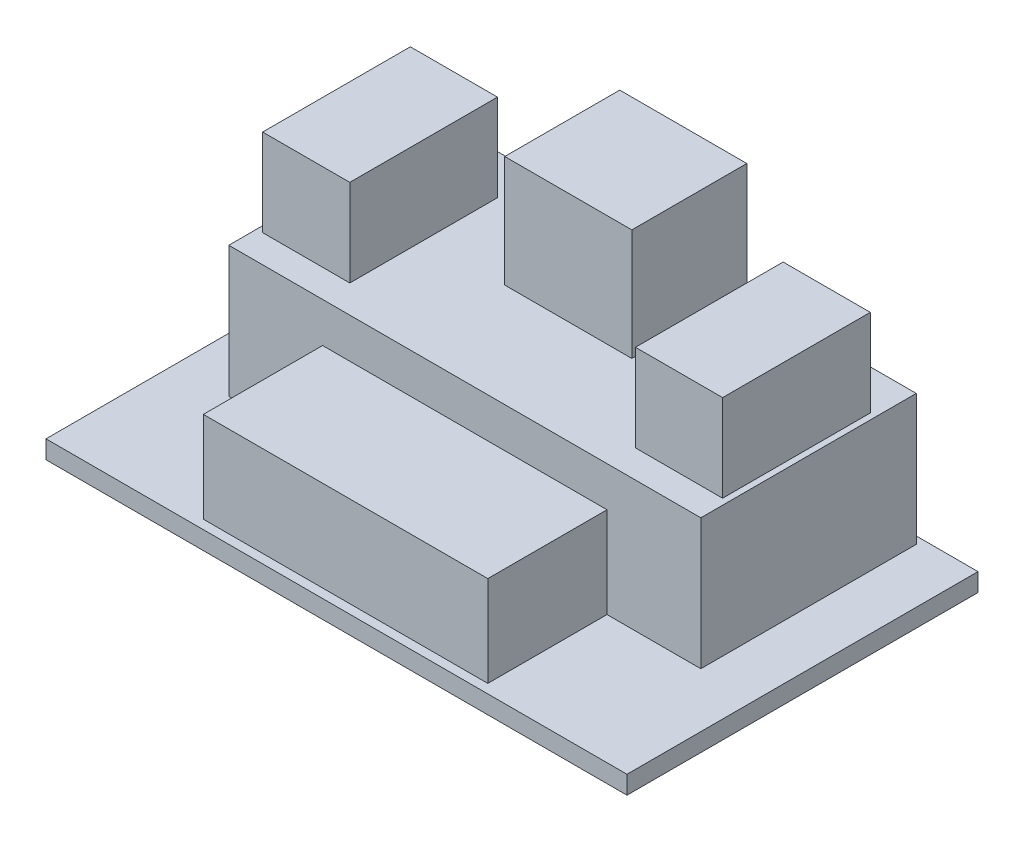
from build123d import *

# Parameters (mm, degrees)
SKETCH_1_W      = 480
SKETCH_1_H      = 290
EXTRUDE_1_DEPTH = 15
SKETCH_2_W      = 390
SKETCH_2_H      = 178
EXTRUDE_2_DEPTH = 108
SKETCH_3_W      = 235
SKETCH_3_H      = 105
EXTRUDE_3_DEPTH = 75
SKETCH_4_W      = 105
SKETCH_4_H      = 95
EXTRUDE_4_DEPTH = 200
SKETCH_5_W      = 72
SKETCH_5_H      = 122
EXTRUDE_5_DEPTH = 180
SKETCH_6_W      = 72
SKETCH_6_H      = 122
EXTRUDE_6_DEPTH = 180


with BuildPart() as part:
    # 草图1 → 凸台-拉伸1 (new body)
    with BuildSketch(Plane(origin=(0, 0, 0), x_dir=(1, 0, 0), z_dir=(0, 1, 0))):
        Rectangle(SKETCH_1_W, SKETCH_1_H)
    extrude(amount=-EXTRUDE_1_DEPTH)

    # 草图2 → 凸台-拉伸2 (add)
    with BuildSketch(Plane(origin=(0, 0, 0), x_dir=(1, 0, 0), z_dir=(0, 1, 0))):
        with Locations((0, 50)):
            Rectangle(SKETCH_2_W, SKETCH_2_H)
    extrude(amount=EXTRUDE_2_DEPTH)

    # 草图3 → 凸台-拉伸3 (add)
    with BuildSketch(Plane(origin=(0, 0, 0), x_dir=(1, 0, 0), z_dir=(0, 1, 0))):
        with Locations((0, -85)):
            Rectangle(SKETCH_3_W, SKETCH_3_H)
    extrude(amount=EXTRUDE_3_DEPTH)

    # 草图4 → 凸台-拉伸4 (add)
    with BuildSketch(Plane(origin=(0, 0, 0), x_dir=(1, 0, 0), z_dir=(0, 1, 0))):
        with Locations((0, 94)):
            Rectangle(SKETCH_4_W, SKETCH_4_H)
    extrude(amount=EXTRUDE_4_DEPTH)

    # 草图5 → 凸台-拉伸5 (add)
    with BuildSketch(Plane(origin=(0, 0, 0), x_dir=(1, 0, 0), z_dir=(0, 1, 0))):
        with Locations((-154, 45)):
            Rectangle(SKETCH_5_W, SKETCH_5_H)
    extrude(amount=EXTRUDE_5_DEPTH)

    # 草图6 → 凸台-拉伸6 (add)
    with BuildSketch(Plane(origin=(0, 0, 0), x_dir=(1, 0, 0), z_dir=(0, 1, 0))):
        with Locations((154, 45)):
            Rectangle(SKETCH_6_W, SKETCH_6_H)
    extrude(amount=EXTRUDE_6_DEPTH)


solid = part.part
